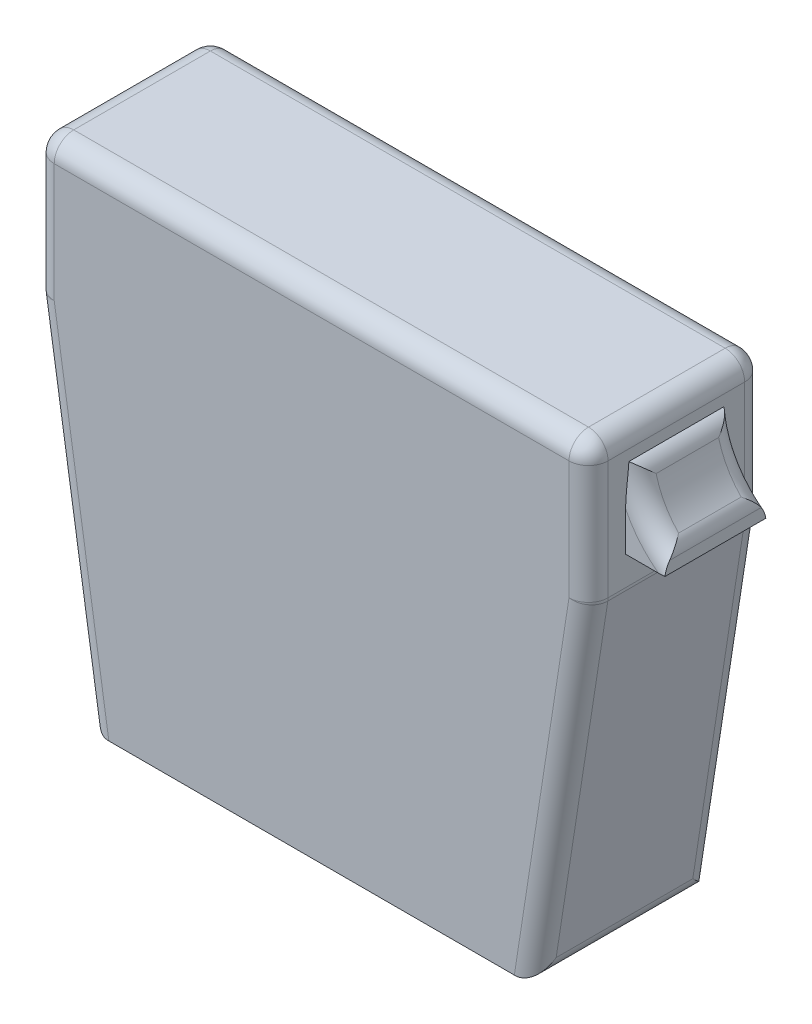
from build123d import *

# Parameters (mm, degrees)
BOSS_EXTRUDE1_DEPTH = 45
SKETCH2_W           = 26.006189056
SKETCH2_H           = 20.126135809
BOSS_EXTRUDE2_DEPTH = 10
SKETCH3_R           = 22.920226204
CUT_EXTRUDE1_DEPTH  = 33
FILLET1_R           = 5
FILLET2_R           = 5


with BuildPart() as part:
    # Sketch1 → Boss-Extrude1 (new body)
    with BuildSketch(Plane.XY):
        Polygon((-70.929913968, 31.492881802), (-70.929913968, -4.255794838), (-56.990550477, -94.56927522), (56.990550477, -94.56927522), (70.929913968, -4.255794838), (70.929913968, 31.492881802), align=None)
    extrude(amount=BOSS_EXTRUDE1_DEPTH)

    # Sketch2 → Boss-Extrude2 (add)
    with BuildSketch(Plane(origin=(70.929913968, 0, 0), x_dir=(0, 0, -1), z_dir=(1, 0, 0))):
        with Locations((-22.5, 13.618543481)):
            Rectangle(SKETCH2_W, SKETCH2_H)
    extrude(amount=BOSS_EXTRUDE2_DEPTH)

    # Sketch3 → Cut-Extrude1 (cut)
    with BuildSketch(Plane.XY.offset(35.503094528)):
        with Locations((95.963397028, 25.985714872)):
            Circle(SKETCH3_R)
    extrude(amount=-CUT_EXTRUDE1_DEPTH, mode=Mode.SUBTRACT)

    # Fillet1
    fillet1_edges = [part.edges().sort_by_distance(p)[0] for p in [
        (-63.960232222, -49.412535029, 45),
        (70.929913968, 31.492881802, 22.5),
        (70.929913968, -4.255794838, 22.5),
        (56.990550477, -94.56927522, 22.5),
        (-56.990550477, -94.56927522, 22.5),
        (-70.929913968, -4.255794838, 22.5),
        (-70.929913968, 31.492881802, 22.5),
        (63.960232222, -49.412535029, 45),
        (70.929913968, 13.618543482, 45),
        (0, 31.492881802, 45),
        (70.929913968, 13.618543482, 0),
        (63.960232222, -49.412535029, 0),
        (-70.929913968, 13.618543482, 45),
        (-63.960232222, -49.412535029, 0),
        (-70.929913968, 13.618543482, 0),
        (0, 31.492881802, 0),
    ]]
    fillet(fillet1_edges, radius=FILLET1_R)

    # Fillet2
    # the kernel refuses this fillet: 5 mm, written as the material it takes off along each edge
    with BuildSketch(Plane(origin=(80.929913968, 8.684525424, 4.131557715), x_dir=(0, -1, 0), z_dir=(0, 0, 1))) as fillet2_piece_1:
        with BuildLine():
            CenterArc((2.146139103, -5), FILLET2_R, 90, 44.149416871)
            ThreePointArc((-1.336520459, -1.412370925), (-0.653275696, -0.720365262), (0, 0))
            Line((0, 0), (2.146139103, 0))
        make_face()
    extrude(amount=36.736884569, mode=Mode.SUBTRACT)
    with BuildSketch(Plane(origin=(73.159277304, 23.681611386, 1.019055512), x_dir=(-1, 0, 0), z_dir=(0, 0, 1))) as fillet2_piece_2:
        with BuildLine():
            CenterArc((4.256496735, 4.570637831), FILLET2_R, 194.254416025, 51.827716126)
            ThreePointArc((-0.589562939, 3.339497856), (-0.232935215, 1.680667414), (0, 0))
            Line((0, 0), (2.229363336, 0))
        make_face()
    extrude(amount=42.961888977, mode=Mode.SUBTRACT)
    with BuildSketch(Plane(origin=(95.963397028, 25.985714872, 9.496905472), x_dir=(-0.9027297705617247, 0.43020804425484166, 0), z_dir=(0.43020804425484166, 0.9027297705617247, 0))) as fillet2_piece_3_section:
        with BuildLine():
            CenterArc((22.920226204 + FILLET2_R, FILLET2_R), FILLET2_R, 180, 90)
            Line((22.920226204, FILLET2_R), (22.920226204, 0))
            Line((22.920226204, 0), (22.920226204 + FILLET2_R, 0))
        make_face()
    fillet2_piece_3 = revolve(axis=Axis((95.963397028, 25.985714872, 9.496905472), (0, 0, 1)), revolution_arc=105.742769493, mode=Mode.PRIVATE)
    fillet2_piece_3 = split(fillet2_piece_3, bisect_by=Plane(origin=(70.929913968, 25.985714872, 9.496905472), z_dir=(1, 0, 0)), keep=Keep.TOP, mode=Mode.PRIVATE)
    add(fillet2_piece_3, mode=Mode.SUBTRACT)
    with BuildSketch(Plane(origin=(95.963397028, 25.985714872, 35.503094528), x_dir=(-0.9027297705617229, 0.4302080442548457, 0), z_dir=(0.4302080442548457, 0.9027297705617229, 0))) as fillet2_piece_4_section:
        with BuildLine():
            CenterArc((22.920226204 + FILLET2_R, -FILLET2_R), FILLET2_R, 90, 90)
            Line((22.920226204, -FILLET2_R), (22.920226204, 0))
            Line((22.920226204, 0), (22.920226204 + FILLET2_R, 0))
        make_face()
    fillet2_piece_4 = revolve(axis=Axis((95.963397028, 25.985714872, 35.503094528), (0, 0, 1)), revolution_arc=105.742769493, mode=Mode.PRIVATE)
    fillet2_piece_4 = split(fillet2_piece_4, bisect_by=Plane(origin=(70.929913968, 25.985714872, 35.503094528), z_dir=(1, 0, 0)), keep=Keep.TOP, mode=Mode.PRIVATE)
    add(fillet2_piece_4, mode=Mode.SUBTRACT)


solid = part.part
